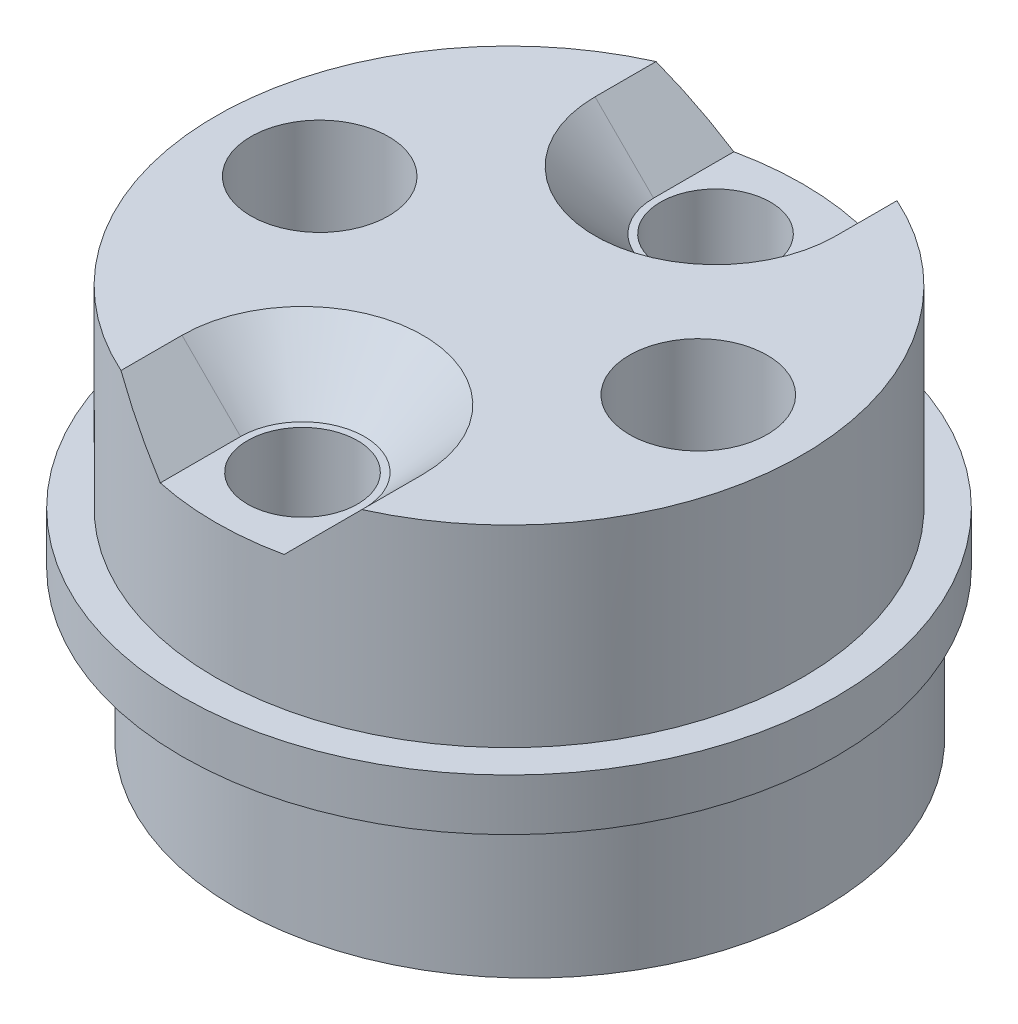
from build123d import *

# Parameters (mm, degrees)
SKETCH1_R            = 8.525
BOSS_EXTRUDE11_DEPTH = 4
SKETCH20_R           = 8.525
BOSS_EXTRUDE12_DEPTH = 4
SKETCH21_R           = 9.5
BOSS_EXTRUDE13_DEPTH = 1.5
SKETCH22_R           = 8.525
BOSS_EXTRUDE14_DEPTH = 5.6
BOSS_EXTRUDE15_START = 14.75
SKETCH30_R           = 8.525
BOSS_EXTRUDE15_DEPTH = 14.75
SKETCH33_R           = 2.1
CUT_EXTRUDE14_DEPTH  = 5.8
BOSS_EXTRUDE16_START = 1.25
SKETCH35_R           = 9.5
BOSS_EXTRUDE16_DEPTH = 1.25
SKETCH36_R           = 1.6
CUT_EXTRUDE15_DEPTH  = 29.85
CIRPATTERN1_COUNT    = 2
SKETCH43_R           = 1.55
CUT_EXTRUDE20_DEPTH  = 29.85
SKETCH44_R           = 2
CUT_EXTRUDE21_DEPTH  = 4
CUT_EXTRUDE22_DEPTH  = 1.7
CUT_EXTRUDE23_DEPTH  = 3
SKETCH47_W           = 28.870202412
SKETCH47_H           = 25.831233738
CUT_EXTRUDE24_DEPTH  = 18.75
SKETCH48_W           = 6
SKETCH48_H           = 6
BOSS_EXTRUDE17_DEPTH = 3
FILLET1_R            = 0.6
CHAMFER1_SIZE        = 1.7


with BuildPart() as part:
    # Sketch1 → Boss-Extrude11 (new body)
    with BuildSketch(Plane(origin=(0, 0, 0), x_dir=(1, 0, 0), z_dir=(0, 1, 0))):
        with Locations(Location((0, 0, 0), (0, 0, 270))):
            Circle(SKETCH1_R)
    extrude(amount=BOSS_EXTRUDE11_DEPTH)

    # Sketch20 → Boss-Extrude12 (add)
    with BuildSketch(Plane(origin=(0, 4, 0), x_dir=(1, 0, 0), z_dir=(0, 1, 0))):
        with Locations(Location((1.2, 0, 0), (0, 0, 94.035884191))):
            Circle(SKETCH20_R)
    extrude(amount=BOSS_EXTRUDE12_DEPTH)

    # Sketch21 → Boss-Extrude13 (add)
    with BuildSketch(Plane(origin=(0, 8, 0), x_dir=(1, 0, 0), z_dir=(0, 1, 0))):
        with Locations(Location((0.6, 0, 0), (0, 0, 270))):
            Circle(SKETCH21_R)
    extrude(amount=BOSS_EXTRUDE13_DEPTH)

    # Sketch22 → Boss-Extrude14 (add)
    with BuildSketch(Plane(origin=(0, 9.5, 0), x_dir=(1, 0, 0), z_dir=(0, 1, 0))):
        with Locations(Location((0.6, 0, 0), (0, 0, 270))):
            Circle(SKETCH22_R)
    extrude(amount=BOSS_EXTRUDE14_DEPTH)

    # Sketch30 → Boss-Extrude15 (add)
    with BuildSketch(Plane.XZ.offset(BOSS_EXTRUDE15_START)):
        with Locations(Location((0.6, 0, 0), (0, 0, 90))):
            Circle(SKETCH30_R)
    extrude(amount=-BOSS_EXTRUDE15_DEPTH)

    # Sketch33 → Cut-Extrude14 (cut)
    with BuildSketch(Plane.XZ.offset(14.75)):
        with Locations(Location((0.6, 0, 0), (0, 0, 270))):
            Circle(SKETCH33_R)
    extrude(amount=-CUT_EXTRUDE14_DEPTH, mode=Mode.SUBTRACT)

    # Sketch35 → Boss-Extrude16 (add)
    with BuildSketch(Plane.XZ.offset(BOSS_EXTRUDE16_START)):
        with Locations(Location((0.6, 0, 0), (0, 0, 90))):
            Circle(SKETCH35_R)
    extrude(amount=-BOSS_EXTRUDE16_DEPTH)

    # Sketch36 → Cut-Extrude15 (cut)
    with BuildSketch(Plane.XZ.offset(14.75)):
        with Locations(Location((0.6, 6, 0), (0, 0, 270))):
            Circle(SKETCH36_R)
    cut_extrude15 = extrude(amount=-CUT_EXTRUDE15_DEPTH, mode=Mode.SUBTRACT)

    # CirPattern1: Cut-Extrude15 ×2 about axis
    cirpattern1_axis = Axis((0.6, 0, 0), (0, 1, 0))
    for i in range(1, CIRPATTERN1_COUNT):
        add(cut_extrude15.rotate(cirpattern1_axis, i * 360 / CIRPATTERN1_COUNT), mode=Mode.SUBTRACT)

    # Sketch43 → Cut-Extrude20 (cut)
    with BuildSketch(Plane.XZ.offset(14.75)):
        with Locations(Location((-4.9, 0, 0), (0, 0, 270))):
            Circle(SKETCH43_R)
        with Locations(Location((6.1, 0, 0), (0, 0, 270))):
            Circle(SKETCH43_R)
    extrude(amount=-CUT_EXTRUDE20_DEPTH, mode=Mode.SUBTRACT)

    # Sketch44 → Cut-Extrude21 (cut)
    with BuildSketch(Plane(origin=(0, 15.1, 0), x_dir=(1, 0, 0), z_dir=(0, 1, 0))):
        with Locations(Location((-4.9, 0, 0), (0, 0, 270))):
            Circle(SKETCH44_R)
        with Locations(Location((6.1, 0, 0), (0, 0, 270))):
            Circle(SKETCH44_R)
    extrude(amount=-CUT_EXTRUDE21_DEPTH, mode=Mode.SUBTRACT)

    # Sketch45 → Cut-Extrude22 (cut)
    with BuildSketch(Plane(origin=(0, 15.1, 0), x_dir=(1, 0, 0), z_dir=(0, 1, 0))):
        with BuildLine():
            Line((-2.9, -6), (-2.9, -10.872564071))
            Line((-2.9, -10.872564071), (4.1, -10.872564071))
            Line((4.1, -10.872564071), (4.1, -6))
            ThreePointArc((4.1, -6), (0.6, -2.5), (-2.9, -6))
        make_face()
        with BuildLine():
            Line((-2.9, 6), (-2.9, 11.42214608))
            Line((-2.9, 11.42214608), (4.1, 11.42214608))
            Line((4.1, 11.42214608), (4.1, 6))
            ThreePointArc((4.1, 6), (0.6, 2.5), (-2.9, 6))
        make_face()
    extrude(amount=-CUT_EXTRUDE22_DEPTH, mode=Mode.SUBTRACT)

    # Sketch46 → Cut-Extrude23 (cut)
    with BuildSketch(Plane.XZ.offset(14.75)):
        with BuildLine():
            Line((-4.9, 3), (-9.719928829, 3))
            Line((-9.719928829, 3), (-9.719928829, -3))
            Line((-9.719928829, -3), (-4.9, -3))
            ThreePointArc((-4.9, -3), (-1.9, 0), (-4.9, 3))
        make_face()
        with BuildLine():
            Line((6.1, 3), (10.889396495, 3))
            Line((10.889396495, 3), (10.889396495, -3))
            Line((10.889396495, -3), (6.1, -3))
            ThreePointArc((6.1, -3), (3.1, 0), (6.1, 3))
        make_face()
    extrude(amount=-CUT_EXTRUDE23_DEPTH, mode=Mode.SUBTRACT)

    # Sketch47 → Cut-Extrude24 (cut)
    with BuildSketch(Plane.XZ.offset(14.75)):
        with Locations((1.011527008, 0.205763504)):
            Rectangle(SKETCH47_W, SKETCH47_H)
    extrude(amount=-CUT_EXTRUDE24_DEPTH, mode=Mode.SUBTRACT)

    # Sketch48 → Boss-Extrude17 (add)
    with BuildSketch(Plane.XZ.offset(-4)):
        with Locations((1.2, 0)):
            Rectangle(SKETCH48_W, SKETCH48_H)
    extrude(amount=BOSS_EXTRUDE17_DEPTH)

    # Fillet1
    fillet1_edges = [part.edges().sort_by_distance(p)[0] for p in [
        (-1.8, 1, 0),
        (1.2, 1, -3),
        (4.2, 1, 0),
        (1.2, 1, 3),
    ]]
    fillet(fillet1_edges, radius=FILLET1_R)

    # Chamfer1
    chamfer1_edges = [part.edges().sort_by_distance(p)[0] for p in [
        (4.1, 13.4, 6.886696058),
        (-2.9, 13.4, 6.886696058),
        (-2.9, 13.4, -6.886696058),
        (4.1, 13.4, -6.886696058),
        (0.6, 13.4, 2.5),
        (0.6, 13.4, -2.5),
    ]]
    chamfer(chamfer1_edges, length=CHAMFER1_SIZE - 0.0001)  # a hair under: the kernel refuses the full size


solid = part.part
